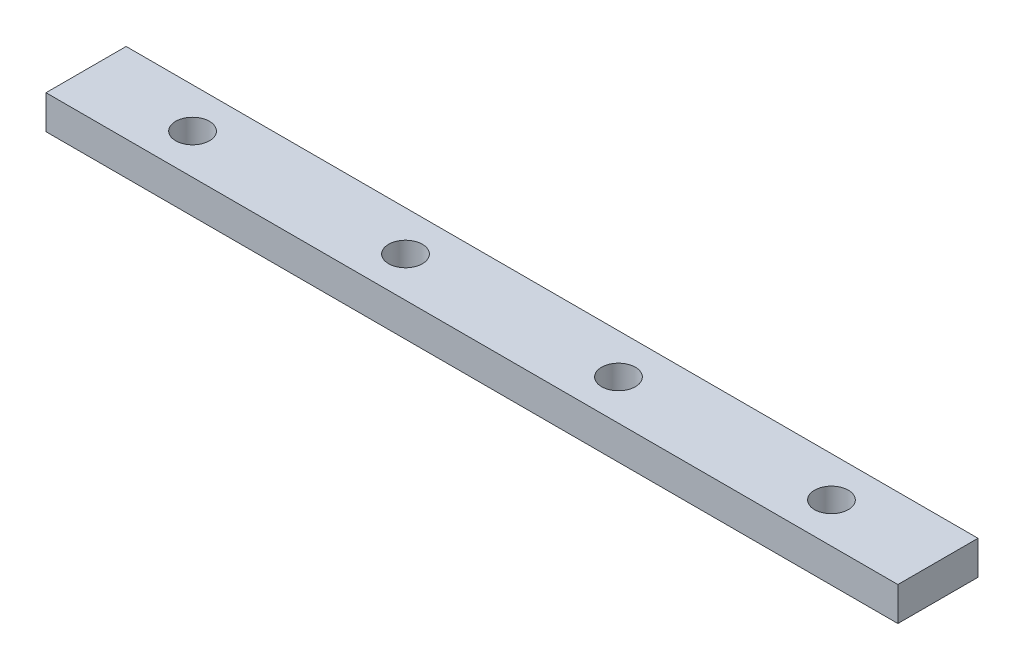
from build123d import *

# Parameters (mm, degrees)
SKETCH1_W           = 30.1
SKETCH1_H           = 12.7
BOSS_EXTRUDE1_DEPTH = 320
SKETCH3_R           = 6.35
CUT_EXTRUDE1_DEPTH  = 322.663333316


with BuildPart() as part:
    # Sketch1 → Boss-Extrude1 (new body)
    with BuildSketch(Plane(origin=(0, 0, 0), x_dir=(0, 0, -1), z_dir=(1, 0, 0))):
        with Locations((15.05, 6.35)):
            Rectangle(SKETCH1_W, SKETCH1_H)
    extrude(amount=BOSS_EXTRUDE1_DEPTH)

    # Sketch3 → Cut-Extrude1 (cut, through all)
    with BuildSketch(Plane(origin=(0, 12.7, 0), x_dir=(1, 0, 0), z_dir=(0, 1, 0))):
        with Locations((120, 15.05)):
            Circle(SKETCH3_R)
        with Locations((200, 15.05)):
            Circle(SKETCH3_R)
        with Locations((280, 15.05)):
            Circle(SKETCH3_R)
        with Locations((40, 15.05)):
            Circle(SKETCH3_R)
    extrude(amount=-CUT_EXTRUDE1_DEPTH, mode=Mode.SUBTRACT)


solid = part.part
